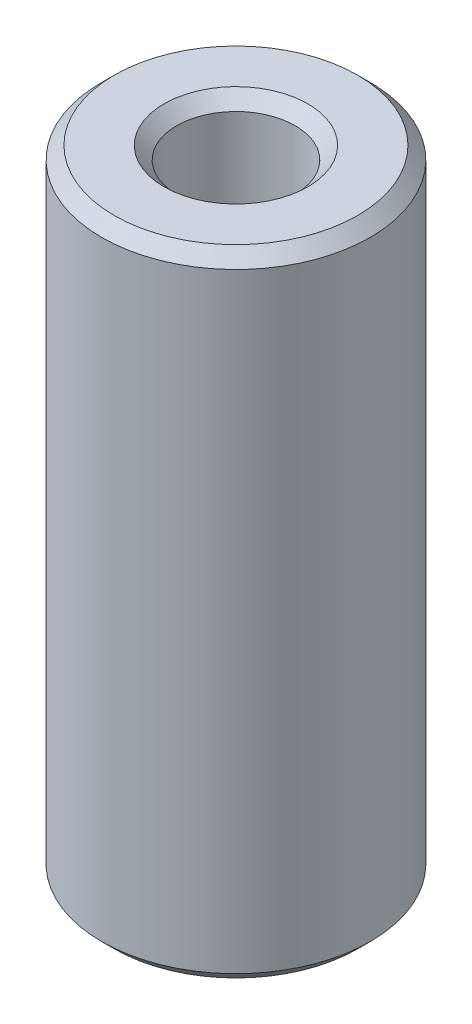
from build123d import *

# Parameters (mm, degrees)
SKETCH1_R           = 30
BOSS_EXTRUDE1_DEPTH = 141.906528759
SKETCH2_R           = 13.247547253
CUT_EXTRUDE1_DEPTH  = 149.113007209
CHAMFER1_SIZE       = 2.820882007


with BuildPart() as part:
    # Sketch1 → Boss-Extrude1 (new body)
    with BuildSketch(Plane(origin=(0, 0, 0), x_dir=(1, 0, 0), z_dir=(0, 1, 0))):
        Circle(SKETCH1_R)
    extrude(amount=BOSS_EXTRUDE1_DEPTH)

    # Sketch2 → Cut-Extrude1 (cut, through all)
    with BuildSketch(Plane(origin=(0, 0, 0), x_dir=(1, 0, 0), z_dir=(0, 1, 0))):
        Circle(SKETCH2_R)
    extrude(amount=CUT_EXTRUDE1_DEPTH, mode=Mode.SUBTRACT)

    # Chamfer1
    chamfer1_edges = [part.edges().sort_by_distance(p)[0] for p in [
        (-13.247547253, 141.906528759, 0),
        (-13.247547253, 0, 0),
        (-30, 0, 0),
        (-30, 141.906528759, 0),
    ]]
    chamfer(chamfer1_edges, length=CHAMFER1_SIZE)


solid = part.part
